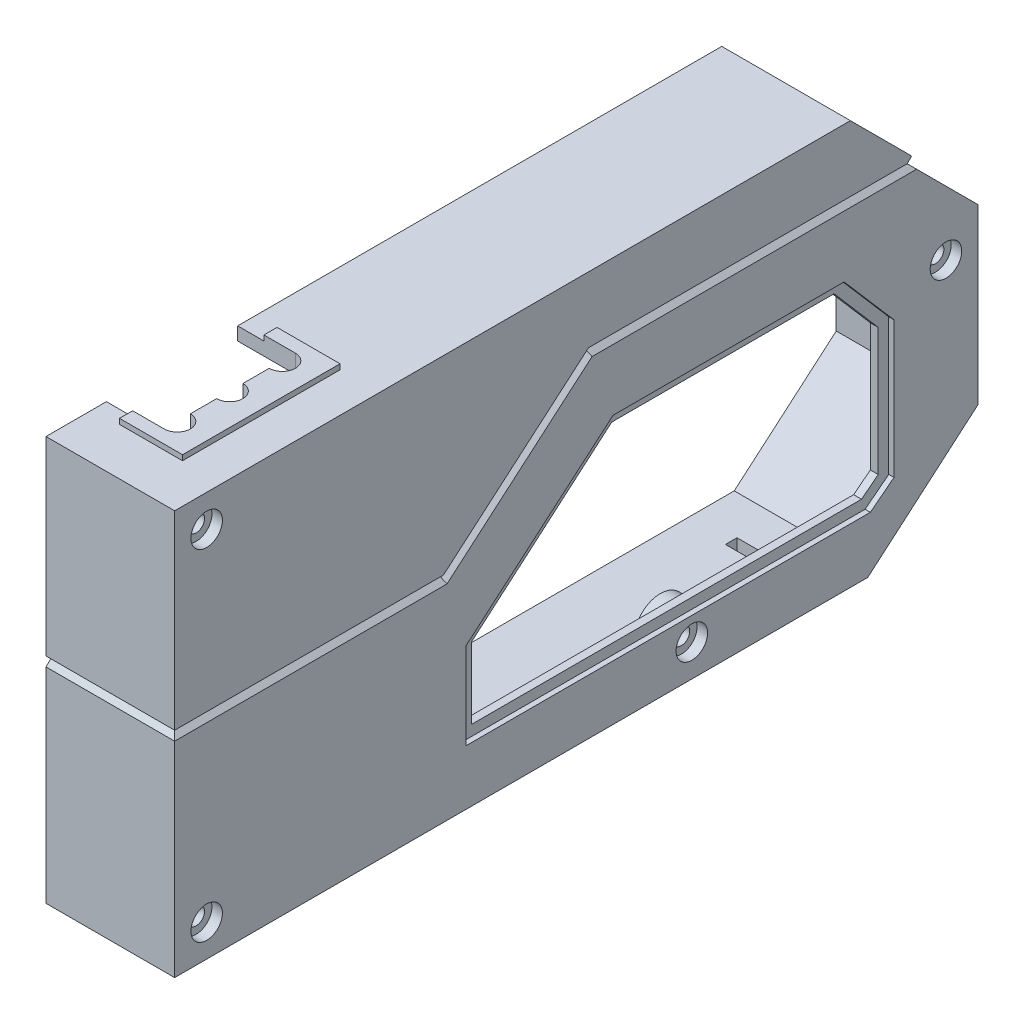
from build123d import *

# Parameters (mm, degrees)
BASE_DEPTH            = 2.5
BOSS_EXTRUDE6_DEPTH   = 22
SKETCH17_W            = 12
SKETCH17_H            = 30
BOSS_EXTRUDE8_DEPTH   = 1
CUT_EXTRUDE2_REACH    = 175.139
BOSS_EXTRUDE9_DEPTH   = 24.5
SKETCH20_W            = 17
SKETCH20_H            = 8.5
CUT_EXTRUDE5_DEPTH    = 1.2
CUT_EXTRUDE6_DEPTH    = 5
SKETCH28_R            = 5
BOSS_EXTRUDE11_DEPTH  = 6
SKETCH29_R            = 3
CUT_EXTRUDE11_DEPTH   = 2
CUT_EXTRUDE12_REACH   = 175.203
SKETCH30_R            = 1.6
SKETCH31_W            = 10
SKETCH31_H            = 25
BATTERY_SUPPORT_DEPTH = 3.4
CUT_EXTRUDE9_DEPTH    = 1
CUT_EXTRUDE10_REACH   = 175.336
CUT_EXTRUDE13_DEPTH   = 1
SKETCH33_W            = 23.5
SKETCH33_H            = 0.8
CUT_EXTRUDE14_DEPTH   = 1
CHAMFER1_SIZE         = 1
CUT_EXTRUDE7_REACH    = 175.139
SKETCH23_W            = 6
SKETCH23_H            = 2.2


with BuildPart() as part:
    # Sketch1 → Base (new body)
    with BuildSketch(Plane(origin=(0, 0, 0), x_dir=(0, 0, -1), z_dir=(1, 0, 0))):
        Polygon((0, 0), (0, 77), (127, 77), (153, 51), (153, 18), (132, 0), align=None)
    extrude(amount=BASE_DEPTH)

    # Sketch11 → Boss-Extrude6 (add)
    with BuildSketch(Plane.ZY):
        Polygon((-153, 18), (-132, 0), (0, 0), (0, 77), (-127, 77), (-153, 51), align=None)
        Polygon((-150.5, 19.149837306), (-131.075189809, 2.5), (-2.5, 2.5), (-2.5, 74.5), (-125.964466094, 74.5), (-150.5, 49.964466094), align=None, mode=Mode.SUBTRACT)
    extrude(amount=BOSS_EXTRUDE6_DEPTH)

    # Sketch17 → Boss-Extrude8 (add)
    with BuildSketch(Plane(origin=(0, 77, 0), x_dir=(1, 0, 0), z_dir=(0, 1, 0))):
        with Locations((-11, 24)):
            Rectangle(SKETCH17_W, SKETCH17_H)
    extrude(amount=BOSS_EXTRUDE8_DEPTH)

    # Sketch13 → Cut-Extrude2 (cut, up to next)
    with BuildSketch(Plane(origin=(0, 78, 0), x_dir=(1, 0, 0), z_dir=(0, 1, 0)), mode=Mode.PRIVATE) as cut_extrude2_sk1:
        with BuildLine():
            Line((-22, 11.5), (-11, 11.5))
            ThreePointArc((-11, 11.5), (-8.5, 14), (-11, 16.5))
            Line((-11, 16.5), (-11, 21.5))
            ThreePointArc((-11, 21.5), (-8.5, 24), (-11, 26.5))
            Line((-11, 26.5), (-11, 31.5))
            ThreePointArc((-11, 31.5), (-8.5, 34), (-11, 36.5))
            Line((-11, 36.5), (-22, 36.5))
            Line((-22, 36.5), (-22, 11.5))
        make_face()
    cut_extrude2_tool1 = extrude(cut_extrude2_sk1.sketch, amount=-CUT_EXTRUDE2_REACH, mode=Mode.PRIVATE) & part.part
    add(cut_extrude2_tool1.solids().sort_by_distance((-15.865292, 78, -24))[0], mode=Mode.SUBTRACT)

    # Sketch19 → Boss-Extrude9 (add)
    with BuildSketch(Plane(origin=(2.5, 0, 0), x_dir=(0, 0, -1), z_dir=(1, 0, 0))):
        Polygon((127, 77), (128.697056275, 77), (140.364318164, 65.33273811), (139.515790027, 64.484209973), align=None)
    extrude(amount=-BOSS_EXTRUDE9_DEPTH)

    # Sketch20 → Cut-Extrude5 (cut)
    with BuildSketch(Plane(origin=(0, 102.848528137, -102.848528137), x_dir=(-1, 0, 0), z_dir=(0, 0.7071067811865467, -0.7071067811865485))):
        with Locations((11, -48.805339059)):
            Rectangle(SKETCH20_W, SKETCH20_H)
    extrude(amount=-CUT_EXTRUDE5_DEPTH, mode=Mode.SUBTRACT)

    # Sketch21 → Cut-Extrude6 (cut, symmetric)
    with BuildSketch(Plane(origin=(0, 102, -102), x_dir=(-1, 0, 0), z_dir=(0, 0.7071067811865478, -0.7071067811865472))):
        with BuildLine():
            Line((11, -48.005339059), (22, -48.005339059))
            Line((22, -48.005339059), (22, -53.105339059))
            Line((22, -53.105339059), (11, -53.105339059))
            ThreePointArc((11, -53.105339059), (8.45, -50.555339059), (11, -48.005339059))
        make_face()
    extrude(amount=CUT_EXTRUDE6_DEPTH, both=True, mode=Mode.SUBTRACT)

    # Sketch28 → Boss-Extrude11 (add)
    with BuildSketch(Plane(origin=(2.5, 0, 0), x_dir=(0, 0, -1), z_dir=(1, 0, 0))):
        with Locations((6.1, 70.9)):
            Circle(SKETCH28_R)
        with Locations((146.9, 44.9)):
            Circle(SKETCH28_R)
        with Locations((98.5, 6.1)):
            Circle(SKETCH28_R)
        with Locations((6.1, 6.1)):
            Circle(SKETCH28_R)
    extrude(amount=-BOSS_EXTRUDE11_DEPTH)

    # Sketch29 → Cut-Extrude11 (cut)
    with BuildSketch(Plane(origin=(2.5, 0, 0), x_dir=(0, 0, -1), z_dir=(1, 0, 0))):
        with Locations((6.1, 70.9)):
            Circle(SKETCH29_R)
        with Locations((146.9, 44.9)):
            Circle(SKETCH29_R)
        with Locations((98.5, 6.1)):
            Circle(SKETCH29_R)
        with Locations((6.1, 6.1)):
            Circle(SKETCH29_R)
    extrude(amount=-CUT_EXTRUDE11_DEPTH, mode=Mode.SUBTRACT)

    # Sketch30 → Cut-Extrude12 (cut, up to next)
    with BuildSketch(Plane(origin=(0.5, 0, 0), x_dir=(0, 0, -1), z_dir=(1, 0, 0)), mode=Mode.PRIVATE) as cut_extrude12_sk1:
        with Locations((6.1, 70.9)):
            Circle(SKETCH30_R)
    cut_extrude12_tool1 = extrude(cut_extrude12_sk1.sketch, amount=-CUT_EXTRUDE12_REACH, mode=Mode.PRIVATE) & part.part
    # Sketch30 → Cut-Extrude12 (cut, up to next)
    with BuildSketch(Plane(origin=(0.5, 0, 0), x_dir=(0, 0, -1), z_dir=(1, 0, 0)), mode=Mode.PRIVATE) as cut_extrude12_sk2:
        with Locations((6.1, 6.1)):
            Circle(SKETCH30_R)
    cut_extrude12_tool2 = extrude(cut_extrude12_sk2.sketch, amount=-CUT_EXTRUDE12_REACH, mode=Mode.PRIVATE) & part.part
    # Sketch30 → Cut-Extrude12 (cut, up to next)
    with BuildSketch(Plane(origin=(0.5, 0, 0), x_dir=(0, 0, -1), z_dir=(1, 0, 0)), mode=Mode.PRIVATE) as cut_extrude12_sk3:
        with Locations((146.9, 44.9)):
            Circle(SKETCH30_R)
    cut_extrude12_tool3 = extrude(cut_extrude12_sk3.sketch, amount=-CUT_EXTRUDE12_REACH, mode=Mode.PRIVATE) & part.part
    # Sketch30 → Cut-Extrude12 (cut, up to next)
    with BuildSketch(Plane(origin=(0.5, 0, 0), x_dir=(0, 0, -1), z_dir=(1, 0, 0)), mode=Mode.PRIVATE) as cut_extrude12_sk4:
        with Locations((98.5, 6.1)):
            Circle(SKETCH30_R)
    cut_extrude12_tool4 = extrude(cut_extrude12_sk4.sketch, amount=-CUT_EXTRUDE12_REACH, mode=Mode.PRIVATE) & part.part
    add(cut_extrude12_tool1.solids().sort_by_distance((0.5, 70.9, -6.1))[0], mode=Mode.SUBTRACT)
    add(cut_extrude12_tool2.solids().sort_by_distance((0.5, 6.1, -6.1))[0], mode=Mode.SUBTRACT)
    add(cut_extrude12_tool3.solids().sort_by_distance((0.5, 44.9, -146.9))[0], mode=Mode.SUBTRACT)
    add(cut_extrude12_tool4.solids().sort_by_distance((0.5, 6.1, -98.5))[0], mode=Mode.SUBTRACT)

    # Sketch31 → Battery_Support (add)
    with BuildSketch(Plane.ZY):
        with Locations((-9.5, 35)):
            Rectangle(SKETCH31_W, SKETCH31_H)
    extrude(amount=BATTERY_SUPPORT_DEPTH)

    # Sketch25 → Cut-Extrude9 (cut)
    with BuildSketch(Plane(origin=(2.5, 0, 0), x_dir=(0, 0, -1), z_dir=(1, 0, 0))):
        Polygon((55.5, 10.5), (132.5, 10.5), (137, 14), (137, 40), (127.5, 51), (83.5, 51), (55.5, 27), align=None)
    extrude(amount=-CUT_EXTRUDE9_DEPTH, mode=Mode.SUBTRACT)

    # Sketch26 → Cut-Extrude10 (cut, up to next)
    with BuildSketch(Plane(origin=(1.5, 0, 0), x_dir=(0, 0, -1), z_dir=(1, 0, 0)), mode=Mode.PRIVATE) as cut_extrude10_sk1:
        Polygon((57.5, 26.080130155), (57.5, 12.5), (131.8137845, 12.5), (135, 14.978167611), (135, 39.255906978), (126.584646936, 49), (84.239848152, 49), align=None)
    cut_extrude10_tool1 = extrude(cut_extrude10_sk1.sketch, amount=-CUT_EXTRUDE10_REACH, mode=Mode.PRIVATE) & part.part
    add(cut_extrude10_tool1.solids().sort_by_distance((1.5, 29.217081, -99.285701))[0], mode=Mode.SUBTRACT)

    # Sketch32 → Cut-Extrude13 (cut)
    with BuildSketch(Plane(origin=(2.5, 0, 0), x_dir=(0, 0, -1), z_dir=(1, 0, 0))):
        Polygon((144.515790027, 63.684209973), (79.121592497, 63.684209973), (51.490014195, 40), (0, 40), (0, 40.8), (51.194074935, 40.8), (78.825653236, 64.484209973), (144.515790027, 64.484209973), align=None)
    extrude(amount=-CUT_EXTRUDE13_DEPTH, mode=Mode.SUBTRACT)

    # Sketch33 → Cut-Extrude14 (cut)
    with BuildSketch(Plane.XY):
        with Locations((-10.25, 40.4)):
            Rectangle(SKETCH33_W, SKETCH33_H)
    extrude(amount=-CUT_EXTRUDE14_DEPTH, mode=Mode.SUBTRACT)

    # Chamfer1
    chamfer1_edges = [part.edges().sort_by_distance(p)[0] for p in [
        (-9.75, 40, 0),
        (2.5, 40, -25.745007098),
        (2.5, 51.842104986, -65.305803346),
        (2.5, 63.684209973, -109.718691262),
    ]]
    chamfer(chamfer1_edges, length=CHAMFER1_SIZE - 0.0001)  # a hair under: the kernel refuses the full size

    # Sketch23 → Cut-Extrude7 (cut, up to next)
    with BuildSketch(Plane.XZ, mode=Mode.PRIVATE) as cut_extrude7_sk1:
        Polygon((-5.5, -10.5), (-8, -10.5), (-14, -10.5), (-16.5, -10.5), (-16.5, -60.5), (-5.5, -60.5), align=None)
    cut_extrude7_tool1 = extrude(cut_extrude7_sk1.sketch, amount=-CUT_EXTRUDE7_REACH, mode=Mode.PRIVATE) & part.part
    # Sketch23 → Cut-Extrude7 (cut, up to next)
    with BuildSketch(Plane.XZ, mode=Mode.PRIVATE) as cut_extrude7_sk2:
        with Locations((-11, -9.4)):
            Rectangle(SKETCH23_W, SKETCH23_H)
    cut_extrude7_tool2 = extrude(cut_extrude7_sk2.sketch, amount=-CUT_EXTRUDE7_REACH, mode=Mode.PRIVATE) & part.part
    # Sketch23 → Cut-Extrude7 (cut, up to next)
    with BuildSketch(Plane.XZ, mode=Mode.PRIVATE) as cut_extrude7_sk3:
        with Locations((-11, -122.5)):
            Rectangle(SKETCH23_W, SKETCH23_H)
    cut_extrude7_tool3 = extrude(cut_extrude7_sk3.sketch, amount=-CUT_EXTRUDE7_REACH, mode=Mode.PRIVATE) & part.part
    add(cut_extrude7_tool1.solids().sort_by_distance((-11, 0, -35.5))[0], mode=Mode.SUBTRACT)
    add(cut_extrude7_tool2.solids().sort_by_distance((-11, 0, -9.4))[0], mode=Mode.SUBTRACT)
    add(cut_extrude7_tool3.solids().sort_by_distance((-11, 0, -122.5))[0], mode=Mode.SUBTRACT)


solid = part.part
